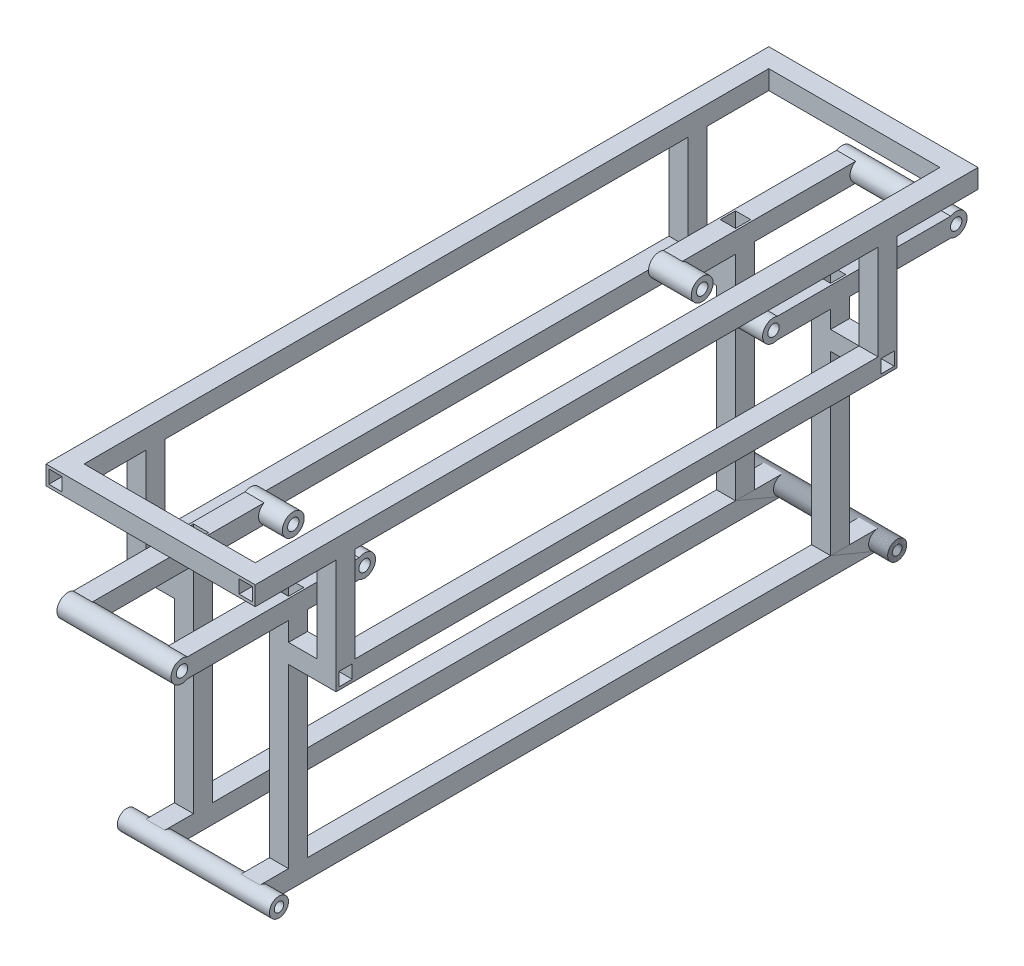
from build123d import *

# Parameters (mm, degrees)
SZKIC1_R                         = 10
SZKIC1_R_2                       = 5
DODANIE_WYCI_GNI_CIE1_DEPTH      = 80
SZKIC2_R                         = 10
SZKIC2_R_2                       = 5
DODANIE_WYCI_GNI_CIE2_DEPTH      = 80
DODANIE_WYCI_GNI_CIE3_REACH      = 346.565
DODANIE_WYCI_GNI_CIE3_END_RADIUS = 10
SZKIC3_W                         = 20
SZKIC3_H                         = 20
SZKIC3_W_2                       = 16
SZKIC3_H_2                       = 16
SZKIC4_W                         = 20
SZKIC4_H                         = 20
SZKIC4_W_2                       = 16
SZKIC4_H_2                       = 16
DODANIE_WYCI_GNI_CIE4_DEPTH      = 246
SZKIC5_W                         = 20
SZKIC5_H                         = 20
SZKIC5_W_2                       = 14
SZKIC5_H_2                       = 14
DODANIE_WYCI_GNI_CIE5_DEPTH      = 112
SZKIC6_R                         = 11.5
DODANIE_WYCI_GNI_CIE6_DEPTH      = 120
SZKIC7_R                         = 6
WYTNIJ_WYCI_GNI_CIE1_DEPTH       = 120
SZKIC8_W                         = 20
SZKIC8_H                         = 20
SZKIC8_W_2                       = 14
SZKIC8_H_2                       = 14
DODANIE_WYCI_GNI_CIE7_DEPTH      = 112
SZKIC9_R                         = 11.5
DODANIE_WYCI_GNI_CIE8_DEPTH      = 120
SZKIC10_R                        = 6
WYTNIJ_WYCI_GNI_CIE2_DEPTH       = 120
SZKIC11_W                        = 20
SZKIC11_H                        = 21.5
SZKIC11_W_2                      = 14
SZKIC11_H_2                      = 15.5
DODANIE_WYCI_GNI_CIE9_DEPTH      = 60
SZKIC12_R                        = 11.5
DODANIE_WYCI_GNI_CIE10_DEPTH     = 120
SZKIC13_W                        = 30
SZKIC13_H                        = 60
WYTNIJ_WYCI_GNI_CIE3_DEPTH       = 60
SZKIC14_R                        = 6
WYTNIJ_WYCI_GNI_CIE4_DEPTH       = 120
SZKIC15_W                        = 20
SZKIC15_H                        = 20
SZKIC15_W_2                      = 14
SZKIC15_H_2                      = 14
DODANIE_WYCI_GNI_CIE11_DEPTH     = 60
SZKIC16_R                        = 11.5
DODANIE_WYCI_GNI_CIE12_DEPTH     = 120
SZKIC17_R                        = 6
WYTNIJ_WYCI_GNI_CIE5_DEPTH       = 120
SZKIC18_W                        = 30
SZKIC18_H                        = 40
WYTNIJ_WYCI_GNI_CIE6_DEPTH       = 60
SZKIC19_W                        = 20
SZKIC19_H                        = 20
SZKIC19_W_2                      = 14
SZKIC19_H_2                      = 14
DODANIE_WYCI_GNI_CIE13_DEPTH     = 50
SZKIC20_W                        = 20
SZKIC20_H                        = 20
SZKIC20_W_2                      = 14
SZKIC20_H_2                      = 14
DODANIE_WYCI_GNI_CIE14_DEPTH     = 50
SZKIC21_W                        = 20
SZKIC21_H                        = 20
SZKIC21_W_2                      = 14
SZKIC21_H_2                      = 14
DODANIE_WYCI_GNI_CIE15_DEPTH     = 100
SZKIC22_W                        = 20
SZKIC22_H                        = 20
SZKIC22_W_2                      = 14
SZKIC22_H_2                      = 14
DODANIE_WYCI_GNI_CIE16_DEPTH     = 100
SZKIC23_W                        = 20
SZKIC23_H                        = 20
SZKIC23_W_2                      = 14
SZKIC23_H_2                      = 14
DODANIE_WYCI_GNI_CIE17_DEPTH     = 675
SZKIC24_W                        = 20
SZKIC24_H                        = 20
SZKIC24_W_2                      = 14
SZKIC24_H_2                      = 14
DODANIE_WYCI_GNI_CIE18_DEPTH     = 85
DODANIE_WYCI_GNI_CIE19_REACH     = 842.053
SZKIC25_W                        = 20
SZKIC25_H                        = 20
SZKIC25_W_2                      = 14
SZKIC25_H_2                      = 14
SZKIC26_W                        = 20
SZKIC26_H                        = 20
SZKIC26_W_2                      = 14
SZKIC26_H_2                      = 14
DODANIE_WYCI_GNI_CIE20_DEPTH     = 550


with BuildPart() as part:
    # Szkic1 → Dodanie-wyciągnięcie1 (new, symmetric)
    with BuildSketch(Plane(origin=(0, 0, 0), x_dir=(0, 0, -1), z_dir=(1, 0, 0))):
        Circle(SZKIC1_R)
        Circle(SZKIC1_R_2, mode=Mode.SUBTRACT)
    extrude(amount=DODANIE_WYCI_GNI_CIE1_DEPTH, both=True)


with BuildPart() as body_2:
    # Szkic2 → Dodanie-wyciągnięcie2 (new, symmetric)
    with BuildSketch(Plane(origin=(0, 0, 0), x_dir=(0, 0, -1), z_dir=(1, 0, 0))):
        with Locations((-650, 0)):
            Circle(SZKIC2_R)
        with Locations((-650, 0)):
            Circle(SZKIC2_R_2, mode=Mode.SUBTRACT)
    extrude(amount=DODANIE_WYCI_GNI_CIE2_DEPTH, both=True)

    # Dodanie-wyciągnięcie3: up to this cylinder (the profile starts outside it)
    dodanie_wyci_gni_cie3_end = Plane(origin=(0, 0, 650), z_dir=(-1, 0, 0)) * Cylinder(DODANIE_WYCI_GNI_CIE3_END_RADIUS, 814.13, mode=Mode.PRIVATE)
    # Szkic3 → Dodanie-wyciągnięcie3 (add, up to the surface)
    with BuildSketch(Plane.XY.offset(325), mode=Mode.PRIVATE) as dodanie_wyci_gni_cie3_sk1:
        with Locations((50, 0)):
            Rectangle(SZKIC3_W, SZKIC3_H)
        with Locations((50, 0)):
            Rectangle(SZKIC3_W_2, SZKIC3_H_2, mode=Mode.SUBTRACT)
    dodanie_wyci_gni_cie3_tool1 = extrude(dodanie_wyci_gni_cie3_sk1.sketch, amount=DODANIE_WYCI_GNI_CIE3_REACH, mode=Mode.PRIVATE) - dodanie_wyci_gni_cie3_end
    add(dodanie_wyci_gni_cie3_tool1.solids().sort_by_distance((50, -9.717157, 325))[0])
    # Szkic3 → Dodanie-wyciągnięcie3 (add, up to the surface)
    with BuildSketch(Plane.XY.offset(325), mode=Mode.PRIVATE) as dodanie_wyci_gni_cie3_sk2:
        with Locations((-50, 0)):
            Rectangle(SZKIC3_W, SZKIC3_H)
        with Locations((-50, 0)):
            Rectangle(SZKIC3_W_2, SZKIC3_H_2, mode=Mode.SUBTRACT)
    dodanie_wyci_gni_cie3_tool2 = extrude(dodanie_wyci_gni_cie3_sk2.sketch, amount=DODANIE_WYCI_GNI_CIE3_REACH, mode=Mode.PRIVATE) - dodanie_wyci_gni_cie3_end
    add(dodanie_wyci_gni_cie3_tool2.solids().sort_by_distance((-50, -9.717157, 325))[0])


with BuildPart() as body_3:
    # Lustro3: mirrored copy
    add(body_2.part.mirror(Plane.XY.offset(325)))


with BuildPart() as body_2_1:
    add(body_2.part)

    # Szkic4 → Dodanie-wyciągnięcie4 (add)
    # profile 1 of 2: a face of its own
    with BuildSketch(Plane(origin=(0, 10, 0), x_dir=(1, 0, 0), z_dir=(0, 1, 0))):
        with Locations((50, -610)):
            Rectangle(SZKIC4_W, SZKIC4_H)
        with Locations((50, -610)):
            Rectangle(SZKIC4_W_2, SZKIC4_H_2, mode=Mode.SUBTRACT)
    # profile 2 of 2: a face of its own
    with BuildSketch(Plane(origin=(0, 10, 0), x_dir=(1, 0, 0), z_dir=(0, 1, 0))):
        with Locations((-50, -610)):
            Rectangle(SZKIC4_W, SZKIC4_H)
        with Locations((-50, -610)):
            Rectangle(SZKIC4_W_2, SZKIC4_H_2, mode=Mode.SUBTRACT)
    extrude(amount=DODANIE_WYCI_GNI_CIE4_DEPTH)


with BuildPart() as body_4:
    # Lustro4: mirrored copy
    add(body_2_1.part.mirror(Plane.XY.offset(325)))

    # Szkic8 → Dodanie-wyciągnięcie7 (add)
    # profile 1 of 2: a face of its own
    with BuildSketch(Plane(origin=(0, 0, 30), x_dir=(-1, 0, 0), z_dir=(0, 0, -1))):
        with Locations((-50, 246)):
            Rectangle(SZKIC8_W, SZKIC8_H)
        with Locations((-50, 246)):
            Rectangle(SZKIC8_W_2, SZKIC8_H_2, mode=Mode.SUBTRACT)
    # profile 2 of 2: a face of its own
    with BuildSketch(Plane(origin=(0, 0, 30), x_dir=(-1, 0, 0), z_dir=(0, 0, -1))):
        with Locations((50, 246)):
            Rectangle(SZKIC8_W, SZKIC8_H)
        with Locations((50, 246)):
            Rectangle(SZKIC8_W_2, SZKIC8_H_2, mode=Mode.SUBTRACT)
    extrude(amount=DODANIE_WYCI_GNI_CIE7_DEPTH)

    # Szkic9 → Dodanie-wyciągnięcie8 (add)
    with BuildSketch(Plane.ZY.offset(60)):
        with Locations(Location((-82, 246, 0), (0, 0, 299.591845794))):
            Circle(SZKIC9_R)
    extrude(amount=-DODANIE_WYCI_GNI_CIE8_DEPTH)

    # Szkic10 → Wytnij-wyciągnięcie2 (cut)
    with BuildSketch(Plane.ZY.offset(60)):
        with Locations(Location((-82, 246, 0), (0, 0, 270))):
            Circle(SZKIC10_R)
    extrude(amount=-WYTNIJ_WYCI_GNI_CIE2_DEPTH, mode=Mode.SUBTRACT)

    # Szkic11 → Dodanie-wyciągnięcie9 (add)
    # profile 1 of 2: a face of its own
    with BuildSketch(Plane.XY.offset(50)):
        with Locations((-50, 245.25)):
            Rectangle(SZKIC11_W, SZKIC11_H)
        with Locations((-50, 245.25)):
            Rectangle(SZKIC11_W_2, SZKIC11_H_2, mode=Mode.SUBTRACT)
    # profile 2 of 2: a face of its own
    with BuildSketch(Plane.XY.offset(50)):
        with Locations((50, 245.25)):
            Rectangle(SZKIC11_W, SZKIC11_H)
        with Locations((50, 245.25)):
            Rectangle(SZKIC11_W_2, SZKIC11_H_2, mode=Mode.SUBTRACT)
    extrude(amount=DODANIE_WYCI_GNI_CIE9_DEPTH)

    # Szkic12 → Dodanie-wyciągnięcie10 (add)
    with BuildSketch(Plane.ZY.offset(60)):
        with Locations(Location((110, 245.25, 0), (0, 0, 249.193052224))):
            Circle(SZKIC12_R)
    extrude(amount=-DODANIE_WYCI_GNI_CIE10_DEPTH)

    # Szkic13 → Wytnij-wyciągnięcie3 (cut, symmetric)
    with BuildSketch(Plane(origin=(0, 256, 0), x_dir=(1, 0, 0), z_dir=(0, 1, 0))):
        with Locations((0, -111.658434929)):
            Rectangle(SZKIC13_W, SZKIC13_H)
    extrude(amount=WYTNIJ_WYCI_GNI_CIE3_DEPTH, both=True, mode=Mode.SUBTRACT)

    # Szkic14 → Wytnij-wyciągnięcie4 (cut)
    with BuildSketch(Plane.ZY.offset(60)):
        with Locations(Location((110, 245.25, 0), (0, 0, 270))):
            Circle(SZKIC14_R)
    extrude(amount=-WYTNIJ_WYCI_GNI_CIE4_DEPTH, mode=Mode.SUBTRACT)

    # Szkic20 → Dodanie-wyciągnięcie14 (add)
    with BuildSketch(Plane(origin=(60, 0, 0), x_dir=(0, 0, -1), z_dir=(1, 0, 0))):
        with Locations((-40, 206)):
            Rectangle(SZKIC20_W, SZKIC20_H)
        with Locations((-40, 206)):
            Rectangle(SZKIC20_W_2, SZKIC20_H_2, mode=Mode.SUBTRACT)
    dodanie_wyci_gni_cie14 = extrude(amount=DODANIE_WYCI_GNI_CIE14_DEPTH)

    # Lustro7: Dodanie-wyciągnięcie14 across plane
    add(dodanie_wyci_gni_cie14.mirror(Plane(origin=(0, 0, 0), x_dir=(0, 0, 1), z_dir=(1, 0, 0))))

    # Szkic22 → Dodanie-wyciągnięcie16 (add)
    with BuildSketch(Plane(origin=(0, 216, 0), x_dir=(1, 0, 0), z_dir=(0, 1, 0))):
        with Locations((100, -40)):
            Rectangle(SZKIC22_W, SZKIC22_H)
        with Locations((100, -40)):
            Rectangle(SZKIC22_W_2, SZKIC22_H_2, mode=Mode.SUBTRACT)
    dodanie_wyci_gni_cie16 = extrude(amount=DODANIE_WYCI_GNI_CIE16_DEPTH)

    # Lustro9: Dodanie-wyciągnięcie16 across plane
    add(dodanie_wyci_gni_cie16.mirror(Plane(origin=(0, 0, 0), x_dir=(0, 0, 1), z_dir=(1, 0, 0))))


with BuildPart() as body_2_2:
    add(body_2_1.part)

    # Szkic5 → Dodanie-wyciągnięcie5 (add)
    # profile 1 of 2: a face of its own
    with BuildSketch(Plane.XY.offset(620)):
        with Locations((-50, 246)):
            Rectangle(SZKIC5_W, SZKIC5_H)
        with Locations((-50, 246)):
            Rectangle(SZKIC5_W_2, SZKIC5_H_2, mode=Mode.SUBTRACT)
    # profile 2 of 2: a face of its own
    with BuildSketch(Plane.XY.offset(620)):
        with Locations((50, 246)):
            Rectangle(SZKIC5_W, SZKIC5_H)
        with Locations((50, 246)):
            Rectangle(SZKIC5_W_2, SZKIC5_H_2, mode=Mode.SUBTRACT)
    extrude(amount=DODANIE_WYCI_GNI_CIE5_DEPTH)

    # Szkic6 → Dodanie-wyciągnięcie6 (add)
    with BuildSketch(Plane(origin=(60, 0, 0), x_dir=(0, 0, -1), z_dir=(1, 0, 0))):
        with Locations(Location((-732, 246, 0), (0, 0, 60.408154206))):
            Circle(SZKIC6_R)
    extrude(amount=-DODANIE_WYCI_GNI_CIE6_DEPTH)

    # Szkic7 → Wytnij-wyciągnięcie1 (cut)
    with BuildSketch(Plane(origin=(60, 0, 0), x_dir=(0, 0, -1), z_dir=(1, 0, 0))):
        with Locations((-732, 246)):
            Circle(SZKIC7_R)
    extrude(amount=-WYTNIJ_WYCI_GNI_CIE1_DEPTH, mode=Mode.SUBTRACT)

    # Szkic15 → Dodanie-wyciągnięcie11 (add)
    # profile 1 of 2: a face of its own
    with BuildSketch(Plane(origin=(0, 0, 600), x_dir=(-1, 0, 0), z_dir=(0, 0, -1))):
        with Locations((-50, 246)):
            Rectangle(SZKIC15_W, SZKIC15_H)
        with Locations((-50, 246)):
            Rectangle(SZKIC15_W_2, SZKIC15_H_2, mode=Mode.SUBTRACT)
    # profile 2 of 2: a face of its own
    with BuildSketch(Plane(origin=(0, 0, 600), x_dir=(-1, 0, 0), z_dir=(0, 0, -1))):
        with Locations((50, 246)):
            Rectangle(SZKIC15_W, SZKIC15_H)
        with Locations((50, 246)):
            Rectangle(SZKIC15_W_2, SZKIC15_H_2, mode=Mode.SUBTRACT)
    extrude(amount=DODANIE_WYCI_GNI_CIE11_DEPTH)

    # Szkic16 → Dodanie-wyciągnięcie12 (add)
    with BuildSketch(Plane(origin=(60, 0, 0), x_dir=(0, 0, -1), z_dir=(1, 0, 0))):
        with Locations(Location((-540, 246, 0), (0, 0, 119.591845794))):
            Circle(SZKIC16_R)
    extrude(amount=-DODANIE_WYCI_GNI_CIE12_DEPTH)

    # Szkic17 → Wytnij-wyciągnięcie5 (cut)
    with BuildSketch(Plane(origin=(60, 0, 0), x_dir=(0, 0, -1), z_dir=(1, 0, 0))):
        with Locations((-540, 246)):
            Circle(SZKIC17_R)
    extrude(amount=-WYTNIJ_WYCI_GNI_CIE5_DEPTH, mode=Mode.SUBTRACT)

    # Szkic18 → Wytnij-wyciągnięcie6 (cut, symmetric)
    with BuildSketch(Plane(origin=(0, 256, 0), x_dir=(1, 0, 0), z_dir=(0, 1, 0))):
        with Locations((0, -538.089628552)):
            Rectangle(SZKIC18_W, SZKIC18_H)
    extrude(amount=WYTNIJ_WYCI_GNI_CIE6_DEPTH, both=True, mode=Mode.SUBTRACT)

    # Szkic19 → Dodanie-wyciągnięcie13 (add)
    with BuildSketch(Plane(origin=(60, 0, 0), x_dir=(0, 0, -1), z_dir=(1, 0, 0))):
        with Locations((-610, 206)):
            Rectangle(SZKIC19_W, SZKIC19_H)
        with Locations((-610, 206)):
            Rectangle(SZKIC19_W_2, SZKIC19_H_2, mode=Mode.SUBTRACT)
    dodanie_wyci_gni_cie13 = extrude(amount=DODANIE_WYCI_GNI_CIE13_DEPTH)

    # Lustro5: Dodanie-wyciągnięcie13 across plane
    add(dodanie_wyci_gni_cie13.mirror(Plane(origin=(0, 0, 0), x_dir=(0, 0, 1), z_dir=(1, 0, 0))))

    # Szkic21 → Dodanie-wyciągnięcie15 (add)
    with BuildSketch(Plane(origin=(0, 216, 0), x_dir=(1, 0, 0), z_dir=(0, 1, 0))):
        with Locations((100, -610)):
            Rectangle(SZKIC21_W, SZKIC21_H)
        with Locations((100, -610)):
            Rectangle(SZKIC21_W_2, SZKIC21_H_2, mode=Mode.SUBTRACT)
    dodanie_wyci_gni_cie15 = extrude(amount=DODANIE_WYCI_GNI_CIE15_DEPTH)

    # Lustro8: Dodanie-wyciągnięcie15 across plane
    add(dodanie_wyci_gni_cie15.mirror(Plane(origin=(0, 0, 0), x_dir=(0, 0, 1), z_dir=(1, 0, 0))))

    # Szkic23 → Dodanie-wyciągnięcie17 (add)
    with BuildSketch(Plane.XY.offset(620)):
        with Locations((100, 326)):
            Rectangle(SZKIC23_W, SZKIC23_H)
        with Locations((100, 326)):
            Rectangle(SZKIC23_W_2, SZKIC23_H_2, mode=Mode.SUBTRACT)
    dodanie_wyci_gni_cie17 = extrude(amount=-DODANIE_WYCI_GNI_CIE17_DEPTH)

    # Szkic24 → Dodanie-wyciągnięcie18 (add)
    with BuildSketch(Plane.XY.offset(620)):
        with Locations((100, 326)):
            Rectangle(SZKIC24_W, SZKIC24_H)
        with Locations((100, 326)):
            Rectangle(SZKIC24_W_2, SZKIC24_H_2, mode=Mode.SUBTRACT)
    dodanie_wyci_gni_cie18 = extrude(amount=DODANIE_WYCI_GNI_CIE18_DEPTH)

    # Lustro10: Dodanie-wyciągnięcie17, Dodanie-wyciągnięcie18 across plane
    add(dodanie_wyci_gni_cie17.mirror(Plane(origin=(0, 0, 0), x_dir=(0, 0, 1), z_dir=(1, 0, 0))))
    add(dodanie_wyci_gni_cie18.mirror(Plane(origin=(0, 0, 0), x_dir=(0, 0, 1), z_dir=(1, 0, 0))))

    # Szkic25 → Dodanie-wyciągnięcie19 (add, up to next)
    with BuildSketch(Plane(origin=(-90, 0, 0), x_dir=(0, 0, -1), z_dir=(1, 0, 0)), mode=Mode.PRIVATE) as dodanie_wyci_gni_cie19_sk1:
        with Locations((-695, 326)):
            Rectangle(SZKIC25_W, SZKIC25_H)
        with Locations((-695, 326)):
            Rectangle(SZKIC25_W_2, SZKIC25_H_2, mode=Mode.SUBTRACT)
    dodanie_wyci_gni_cie19_tool1 = extrude(dodanie_wyci_gni_cie19_sk1.sketch, amount=DODANIE_WYCI_GNI_CIE19_REACH, mode=Mode.PRIVATE) - body_2_2.part
    dodanie_wyci_gni_cie19 = dodanie_wyci_gni_cie19_tool1.solids().sort_by_distance((-90, 335.717157, 695))[0]
    add(dodanie_wyci_gni_cie19)

    # Lustro12: Dodanie-wyciągnięcie19 across plane
    add(dodanie_wyci_gni_cie19.mirror(Plane.XY.offset(325)))

    add(body_4.part)  # Dodanie-wyciągnięcie20 merges body 4
    # Szkic26 → Dodanie-wyciągnięcie20 (add)
    with BuildSketch(Plane.XY.offset(50)):
        with Locations((100, 206)):
            Rectangle(SZKIC26_W, SZKIC26_H)
        with Locations((100, 206)):
            Rectangle(SZKIC26_W_2, SZKIC26_H_2, mode=Mode.SUBTRACT)
    dodanie_wyci_gni_cie20 = extrude(amount=DODANIE_WYCI_GNI_CIE20_DEPTH)

    # Lustro13: Dodanie-wyciągnięcie20 across plane
    add(dodanie_wyci_gni_cie20.mirror(Plane(origin=(0, 0, 0), x_dir=(0, 0, 1), z_dir=(1, 0, 0))))


solid = Compound([part.part, body_3.part, body_2_2.part])
